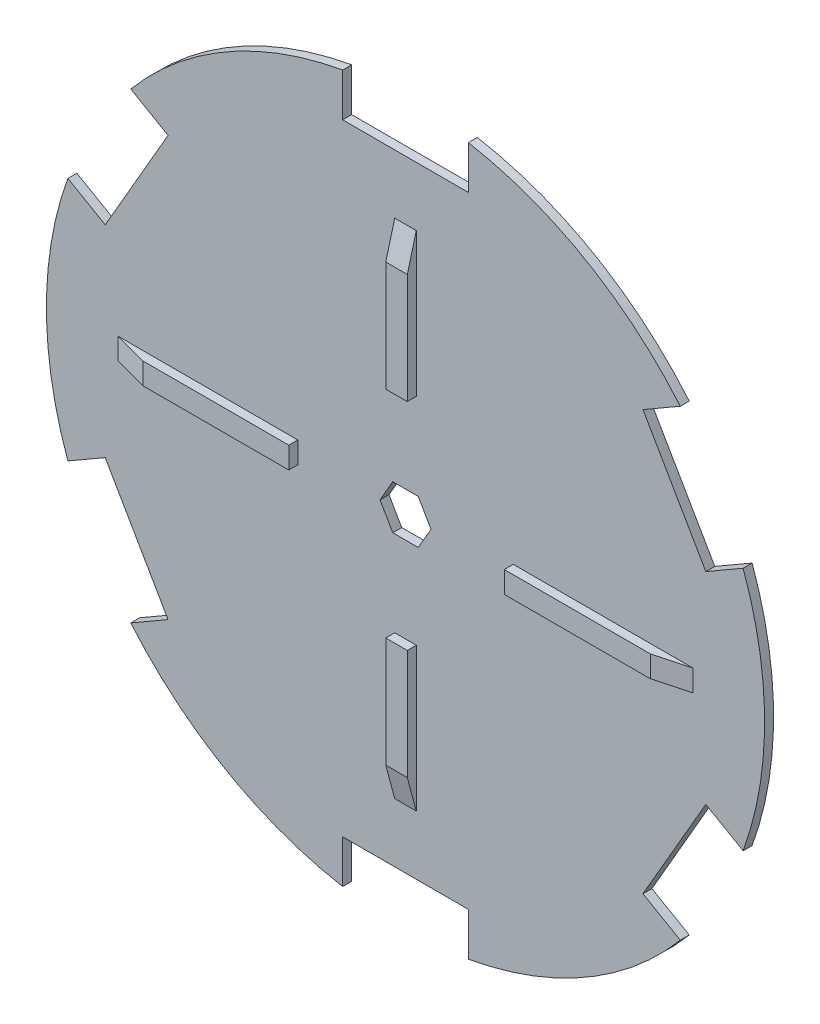
from build123d import *
from OCP.BRepFilletAPI import BRepFilletAPI_MakeChamfer

# Parameters (mm, degrees)
SKETCH1_R           = 100
BOSS_EXTRUDE1_DEPTH = 2.5
SKETCH8_W           = 1.221153846
SKETCH8_H           = 0.325641026
CUT_EXTRUDE6_DEPTH  = 0.2
CUT_EXTRUDE7_DEPTH  = 10
BOSS_EXTRUDE2_DEPTH = 2.5
CHAMFER1_SIZE       = 2.5
CHAMFER1_SIZE_2     = 9.330127019
CUT_EXTRUDE8_DEPTH  = 10


with BuildPart() as part:
    # Sketch1 → Boss-Extrude1 (new body)
    with BuildSketch(Plane.XY):
        Circle(SKETCH1_R)
    extrude(amount=BOSS_EXTRUDE1_DEPTH)

    # Sketch8 → Cut-Extrude6 (cut)
    # profile 1 of 12: a face of its own
    with BuildSketch(Plane(origin=(0, 0, 0), x_dir=(-1, 0, 0), z_dir=(0, 0, -1))):
        with BuildLine():
            add(Edge.make_bspline(
                [(-21.303796635, -42.5044388), (-21.303499075, -42.453550456), (-21.302921062, -42.354699113), (-21.296490852, -42.210658759), (-21.285808934, -42.075530497), (-21.271170032, -41.949307858), (-21.253355578, -41.831958258), (-21.229574387, -41.723795299), (-21.202529916, -41.62431837), (-21.171185911, -41.533203084), (-21.135818417, -41.449221882), (-21.09732448, -41.370821878), (-21.054176417, -41.298121696), (-21.008840217, -41.229960986), (-20.959480695, -41.167455492), (-20.907502507, -41.109722505), (-20.850876948, -41.058096324), (-20.791528933, -41.011064321), (-20.72892114, -40.969835158), (-20.66483815, -40.933519745), (-20.598838876, -40.902495579), (-20.530743124, -40.878102113), (-20.461162947, -40.857953702), (-20.389855107, -40.844175156), (-20.31670187, -40.835505675), (-20.267324783, -40.834676848), (-20.242283213, -40.834256508)],
                knots=[0, 0, 0, 0, 1.646270934, 3.197905019, 4.663502075, 6.030701355, 7.308322542, 8.50163776, 9.611534131, 10.641858119, 11.616356847, 12.558055219, 13.465016945, 14.349605745, 15.204443733, 16.039544428, 16.859896111, 17.680448484, 18.487036065, 19.28249412, 20.06191084, 20.843045899, 21.620316918, 22.403196591, 23.190181807, 24, 24, 24, 24], degree=3))
            add(Edge.make_bspline(
                [(-20.242283213, -40.834256508), (-20.217032458, -40.834699027), (-20.16681665, -40.835579056), (-20.092575738, -40.844037204), (-20.020049955, -40.858071722), (-19.949548501, -40.877957178), (-19.880492263, -40.902627542), (-19.813421379, -40.933549427), (-19.747919241, -40.969543828), (-19.685026766, -41.011838345), (-19.624053507, -41.058993695), (-19.566497141, -41.112299831), (-19.512352427, -41.171218505), (-19.460939829, -41.235119338), (-19.413717966, -41.305227951), (-19.368747781, -41.380324965), (-19.328496005, -41.461723678), (-19.28972955, -41.548065959), (-19.256267783, -41.64174085), (-19.226090547, -41.742220311), (-19.201707482, -41.850691181), (-19.181397214, -41.966584346), (-19.165662915, -42.09032542), (-19.154203304, -42.221649149), (-19.148149863, -42.360641932), (-19.147009855, -42.455672267), (-19.14642484, -42.5044388)],
                knots=[0, 0, 0, 0, 0.810914788, 1.612654377, 2.396697861, 3.181598691, 3.963628158, 4.749916497, 5.551656086, 6.361998678, 7.18212741, 8.025565596, 8.878627764, 9.750805457, 10.657531673, 11.591944965, 12.560506719, 13.57287815, 14.630710178, 15.753379473, 16.941251878, 18.199788006, 19.531962791, 20.947069417, 22.433333509, 24, 24, 24, 24], degree=3))
            add(Edge.make_bspline(
                [(-19.14642484, -42.5044388), (-19.14701592, -42.552992631), (-19.148167616, -42.64759779), (-19.154135443, -42.785965175), (-19.165890773, -42.916591971), (-19.180595548, -43.039791462), (-19.200961778, -43.155050874), (-19.226003608, -43.262769052), (-19.253807829, -43.363411174), (-19.288129392, -43.456152753), (-19.325694822, -43.54228753), (-19.366566322, -43.622721301), (-19.41035395, -43.698165009), (-19.458059454, -43.768014779), (-19.508907908, -43.832765418), (-19.563987616, -43.891273976), (-19.621745933, -43.944950228), (-19.682898624, -43.992712776), (-19.74677196, -44.034518277), (-19.812049122, -44.071905127), (-19.879888334, -44.102051929), (-19.948752227, -44.127937288), (-20.019625817, -44.147713412), (-20.092420757, -44.161387553), (-20.166766771, -44.170977729), (-20.217023905, -44.171709322), (-20.242283213, -44.172077021)],
                knots=[0, 0, 0, 0, 1.561518951, 3.042555995, 4.452378317, 5.7783523, 7.031515105, 8.214008947, 9.334062868, 10.386615937, 11.391082383, 12.354592575, 13.286541444, 14.194233754, 15.072674879, 15.931287219, 16.775624067, 17.606195743, 18.42308326, 19.229000347, 20.022332153, 20.807536673, 21.593273796, 22.3848459, 23.188221202, 24, 24, 24, 24], degree=3))
            add(Edge.make_bspline(
                [(-20.242283213, -44.172077021), (-20.267324088, -44.17165397), (-20.316699806, -44.170819796), (-20.389863077, -44.162189483), (-20.460876437, -44.148314276), (-20.530090306, -44.128886357), (-20.597859788, -44.105105755), (-20.663261419, -44.074123485), (-20.72702239, -44.038441865), (-20.788972587, -43.997806019), (-20.847947904, -43.951249921), (-20.904280211, -43.899756602), (-20.956554335, -43.842041078), (-21.005208122, -43.779014677), (-21.051448902, -43.711257236), (-21.093984262, -43.63784364), (-21.133327822, -43.559064986), (-21.169290132, -43.47441231), (-21.201174991, -43.38265034), (-21.229339697, -43.282729299), (-21.25157754, -43.173767258), (-21.270612078, -43.056639361), (-21.285964912, -42.930842295), (-21.296446335, -42.796307768), (-21.302924528, -42.653119614), (-21.303500628, -42.554903462), (-21.303796635, -42.5044388)],
                knots=[0, 0, 0, 0, 0.810891512, 1.598919785, 2.382837074, 3.152667961, 3.926044502, 4.706494248, 5.493654104, 6.291793342, 7.103789334, 7.925228297, 8.761435821, 9.622817696, 10.50288917, 11.416980706, 12.369136599, 13.353924996, 14.394355917, 15.514179734, 16.714354668, 17.994756427, 19.357759367, 20.818452758, 22.365282078, 24, 24, 24, 24], degree=3))
        make_face()
        with BuildLine():
            add(Edge.make_bspline(
                [(-21.018860737, -42.503166765), (-21.018752382, -42.545574513), (-21.018542085, -42.627879625), (-21.013048246, -42.747480298), (-21.005564107, -42.859031953), (-20.99591093, -42.962676233), (-20.981575398, -43.058062315), (-20.965512812, -43.145846242), (-20.945965617, -43.22556345), (-20.922837993, -43.297760964), (-20.896495384, -43.363664048), (-20.867733636, -43.424988007), (-20.836835695, -43.482457264), (-20.802256179, -43.535555608), (-20.764596086, -43.5844562), (-20.724706058, -43.630024555), (-20.681097357, -43.670661817), (-20.620768962, -43.71939975), (-20.541125017, -43.769763535), (-20.440776462, -43.813620345), (-20.337662938, -43.841181574), (-20.267675733, -43.844686552), (-20.232742949, -43.846435996)],
                knots=[0, 0, 0, 0, 1.459021318, 2.831673884, 4.118529203, 5.306027144, 6.411944654, 7.436330062, 8.375795394, 9.233974572, 10.042671642, 10.816086306, 11.563610507, 12.285937304, 12.993564865, 13.685989202, 14.367179055, 15.041617293, 16.353048772, 17.594441528, 18.799311195, 20, 20, 20, 20], degree=3))
            add(Edge.make_bspline(
                [(-20.232742949, -43.846435996), (-20.197584204, -43.84498658), (-20.127339304, -43.842090742), (-20.024710789, -43.814151887), (-19.925079044, -43.771997376), (-19.846999499, -43.722152139), (-19.787597477, -43.674682869), (-19.745037065, -43.63421101), (-19.705973635, -43.588893901), (-19.668924038, -43.53999954), (-19.634943305, -43.486593787), (-19.604043173, -43.42893345), (-19.575846137, -43.36685841), (-19.559781502, -43.323524433), (-19.551568069, -43.301368888)],
                knots=[0, 0, 0, 0, 1.353760809, 2.704726607, 4.075137775, 5.516104923, 6.260822281, 7.007110065, 7.778089737, 8.566572457, 9.372053459, 10.217411131, 11.088608312, 12, 12, 12, 12], degree=3))
            add(Edge.make_bspline(
                [(-19.551568069, -43.301368888), (-19.541996108, -43.273039053), (-19.522560923, -43.215517338), (-19.497513099, -43.126287454), (-19.477786916, -43.032667804), (-19.460040148, -42.935217877), (-19.447927019, -42.833219005), (-19.438177217, -42.726986785), (-19.432434379, -42.616441121), (-19.431722498, -42.541334236), (-19.431360737, -42.503166765)],
                knots=[0, 0, 0, 0, 0.884706709, 1.796334032, 2.740027952, 3.714592787, 4.726048262, 5.777819803, 6.87074269, 8, 8, 8, 8], degree=3))
            add(Edge.make_bspline(
                [(-19.431360737, -42.503166765), (-19.431859838, -42.465005467), (-19.432836184, -42.39035381), (-19.436568159, -42.281026604), (-19.446205259, -42.177187992), (-19.456908745, -42.078390635), (-19.47269051, -41.985181431), (-19.48970652, -41.896780083), (-19.51256762, -41.814281768), (-19.536987702, -41.736394861), (-19.564937132, -41.664004268), (-19.595703548, -41.596772476), (-19.628561858, -41.534374904), (-19.66425089, -41.47698275), (-19.702346974, -41.424338943), (-19.743855608, -41.377498989), (-19.787130289, -41.335011168), (-19.847743022, -41.286512981), (-19.927094699, -41.237063086), (-20.025833251, -41.191555575), (-20.128585906, -41.165422338), (-20.198048968, -41.161737808), (-20.232742949, -41.159897534)],
                knots=[0, 0, 0, 0, 1.31362396, 2.569729283, 3.763502607, 4.902122613, 5.988968491, 7.01645872, 7.998833611, 8.933434873, 9.825090667, 10.667526885, 11.477055099, 12.250526234, 12.991942729, 13.710640831, 14.402115721, 15.076753259, 16.378508321, 17.609869233, 18.806226677, 20, 20, 20, 20], degree=3))
            add(Edge.make_bspline(
                [(-20.232742949, -41.159897534), (-20.267858986, -41.161740346), (-20.338155033, -41.165429328), (-20.441975678, -41.191458208), (-20.541493197, -41.236827113), (-20.620635038, -41.286676765), (-20.681290045, -41.334155091), (-20.724000774, -41.375327088), (-20.764047658, -41.420363333), (-20.800939072, -41.469713642), (-20.835491493, -41.522750082), (-20.867224269, -41.57988989), (-20.895814989, -41.641422628), (-20.922198819, -41.707296108), (-20.945396991, -41.779487394), (-20.964532229, -41.859106409), (-20.98220977, -41.946611125), (-20.994724049, -42.042513822), (-21.005849028, -42.146184061), (-21.012998536, -42.2580142), (-21.018560463, -42.377815459), (-21.018758641, -42.460546124), (-21.018860737, -42.503166765)],
                knots=[0, 0, 0, 0, 1.207732386, 2.417664972, 3.655092373, 4.956220595, 5.625982001, 6.301752483, 6.994047911, 7.697131622, 8.419323945, 9.170223765, 9.943494443, 10.752040957, 11.610060368, 12.549350801, 13.567764191, 14.679664412, 15.874934091, 17.154273443, 18.533957287, 20, 20, 20, 20], degree=3))
        make_face(mode=Mode.SUBTRACT)
    # profile 2 of 12: a face of its own
    with BuildSketch(Plane(origin=(0, 0, 0), x_dir=(-1, 0, 0), z_dir=(0, 0, -1))):
        with BuildLine():
            Line((-18.45443766, -41.892589842), (-18.739373558, -41.892589842))
            add(Edge.make_bspline(
                [(-18.739373558, -41.892589842), (-18.737516498, -41.854788394), (-18.733869281, -41.780547355), (-18.716789333, -41.672303526), (-18.692350108, -41.56883953), (-18.657795718, -41.470986108), (-18.614882166, -41.377878047), (-18.563419927, -41.289885176), (-18.502465505, -41.207343169), (-18.433335111, -41.131017218), (-18.358252131, -41.060997065), (-18.277238886, -41.000531237), (-18.19210804, -40.949443064), (-18.103117871, -40.906733652), (-18.00926436, -40.874675363), (-17.911399196, -40.85088859), (-17.809092408, -40.836577191), (-17.73938753, -40.835038871), (-17.703936859, -40.834256508)],
                knots=[0, 0, 0, 0, 1.10065271, 2.161652631, 3.183658789, 4.190468796, 5.17591951, 6.163126047, 7.15150782, 8.156236427, 9.156009102, 10.134482811, 11.092018607, 12.041330605, 13.001268258, 13.972401359, 14.968799086, 16, 16, 16, 16], degree=3))
            add(Edge.make_bspline(
                [(-17.703936859, -40.834256508), (-17.669122463, -40.835071537), (-17.600713419, -40.836673038), (-17.500871449, -40.850426258), (-17.405823475, -40.871966902), (-17.315755287, -40.902188744), (-17.231385499, -40.942814617), (-17.152080309, -40.99161667), (-17.076895574, -41.048058946), (-17.009216563, -41.114510619), (-16.947069948, -41.185451354), (-16.893455759, -41.261186809), (-16.84754239, -41.33940909), (-16.809272137, -41.420714673), (-16.781099783, -41.505869105), (-16.75971098, -41.593632639), (-16.747621111, -41.684913718), (-16.74576562, -41.746696093), (-16.744822276, -41.778106669)],
                knots=[0, 0, 0, 0, 1.111607364, 2.184268762, 3.212621178, 4.221274766, 5.211760367, 6.196651075, 7.1921475, 8.207485113, 9.220403448, 10.201281604, 11.166441695, 12.114753415, 13.065576456, 14.026450734, 14.996634279, 16, 16, 16, 16], degree=3))
            add(Edge.make_bspline(
                [(-16.744822276, -41.778106669), (-16.746358307, -41.822327919), (-16.749403415, -41.909994398), (-16.775451456, -42.038822167), (-16.816133648, -42.163639054), (-16.865116965, -42.264093606), (-16.914531253, -42.345041133), (-16.959060635, -42.411687744), (-17.011189428, -42.483447704), (-17.071676351, -42.560080718), (-17.139270171, -42.642187039), (-17.214583134, -42.729717067), (-17.298152292, -42.821766459), (-17.356806789, -42.88463654), (-17.38720008, -42.917214241)],
                knots=[0, 0, 0, 0, 1.184426356, 2.348067706, 3.509069118, 4.696110526, 5.333549288, 6.050745305, 6.844228056, 7.710549037, 8.667450064, 9.695053472, 10.805634456, 12, 12, 12, 12], degree=3))
            Line((-17.38720008, -42.917214241), (-18.181586098, -43.765025739))
            Line((-18.181586098, -43.765025739), (-16.704117148, -43.765025739))
            Line((-16.704117148, -43.765025739), (-16.704117148, -44.090666765))
            Line((-16.704117148, -44.090666765), (-18.861488943, -44.090666765))
            Line((-18.861488943, -44.090666765), (-17.630158814, -42.776654345))
            add(Edge.make_bspline(
                [(-17.630158814, -42.776654345), (-17.60017966, -42.745359453), (-17.54259584, -42.685248369), (-17.461150216, -42.597488684), (-17.387999134, -42.516073029), (-17.322669071, -42.441155231), (-17.266577248, -42.371639452), (-17.216800295, -42.309777114), (-17.176917223, -42.252849863), (-17.133632542, -42.186863734), (-17.091709859, -42.106298275), (-17.055685079, -42.007842714), (-17.033718752, -41.906490135), (-17.031083652, -41.837999001), (-17.029758173, -41.803547374)],
                knots=[0, 0, 0, 0, 1.329631726, 2.553950428, 3.673215718, 4.687767853, 5.603093632, 6.413772471, 7.123043292, 7.734684054, 8.834405432, 9.900288307, 10.943827018, 12, 12, 12, 12], degree=3))
            add(Edge.make_bspline(
                [(-17.029758173, -41.803547374), (-17.030334882, -41.781883534), (-17.031471465, -41.739188265), (-17.041502377, -41.676590184), (-17.056661193, -41.616206389), (-17.078382963, -41.557851141), (-17.107054791, -41.502111157), (-17.141955643, -41.448918586), (-17.182223772, -41.397493596), (-17.228806709, -41.349275961), (-17.279980016, -41.305115153), (-17.334040514, -41.265995447), (-17.391235966, -41.233302825), (-17.451325219, -41.206502653), (-17.514140752, -41.185479271), (-17.579804057, -41.170911846), (-17.6481337, -41.161765592), (-17.694791229, -41.160528093), (-17.718565265, -41.159897534)],
                knots=[0, 0, 0, 0, 0.991446411, 1.95395049, 2.89581595, 3.838931463, 4.798493298, 5.75982156, 6.748411868, 7.785213223, 8.824556874, 9.840280684, 10.836137867, 11.835679398, 12.848801643, 13.863922112, 14.911575587, 16, 16, 16, 16], degree=3))
            add(Edge.make_bspline(
                [(-17.718565265, -41.159897534), (-17.74339452, -41.160546171), (-17.792155078, -41.161819985), (-17.863745915, -41.170730545), (-17.93204087, -41.186102843), (-17.997211739, -41.207127398), (-18.059368792, -41.23385051), (-18.118209747, -41.267135164), (-18.17360251, -41.306853047), (-18.225651214, -41.351884123), (-18.273606395, -41.402019733), (-18.315740346, -41.457908771), (-18.352555845, -41.518530783), (-18.384677078, -41.583722197), (-18.410762597, -41.654074554), (-18.430695384, -41.729338115), (-18.446467737, -41.809186083), (-18.451736895, -41.864326838), (-18.45443766, -41.892589842)],
                knots=[0, 0, 0, 0, 1.031018746, 2.02475058, 2.990194455, 3.934040569, 4.864654155, 5.795059489, 6.735614925, 7.690564532, 8.649604399, 9.611025574, 10.590972636, 11.591080095, 12.624614302, 13.701020113, 14.821632451, 16, 16, 16, 16], degree=3))
        make_face()
    # profile 3 of 12: a face of its own
    with BuildSketch(Plane(origin=(0, 0, 0), x_dir=(-1, 0, 0), z_dir=(0, 0, -1))):
        with Locations((-15.808604327, -42.869512919)):
            Rectangle(SKETCH8_W, SKETCH8_H)
    # profile 4 of 12: a face of its own
    with BuildSketch(Plane(origin=(0, 0, 0), x_dir=(-1, 0, 0), z_dir=(0, 0, -1))):
        with BuildLine():
            add(Edge.make_bspline(
                [(-14.953796635, -42.5044388), (-14.953499075, -42.453550456), (-14.952921062, -42.354699113), (-14.946490852, -42.210658759), (-14.935808934, -42.075530497), (-14.921170032, -41.949307858), (-14.903355578, -41.831958258), (-14.879574387, -41.723795299), (-14.852529916, -41.62431837), (-14.821185911, -41.533203084), (-14.785818417, -41.449221882), (-14.74732448, -41.370821878), (-14.704176417, -41.298121696), (-14.658840217, -41.229960986), (-14.609480695, -41.167455492), (-14.557502507, -41.109722505), (-14.500876948, -41.058096324), (-14.441528933, -41.011064321), (-14.37892114, -40.969835158), (-14.31483815, -40.933519745), (-14.248838876, -40.902495579), (-14.180743124, -40.878102113), (-14.111162947, -40.857953702), (-14.039855107, -40.844175156), (-13.96670187, -40.835505675), (-13.917324783, -40.834676848), (-13.892283213, -40.834256508)],
                knots=[0, 0, 0, 0, 1.646270934, 3.197905019, 4.663502075, 6.030701355, 7.308322542, 8.50163776, 9.611534131, 10.641858119, 11.616356847, 12.558055219, 13.465016945, 14.349605745, 15.204443733, 16.039544428, 16.859896111, 17.680448484, 18.487036065, 19.28249412, 20.06191084, 20.843045899, 21.620316918, 22.403196591, 23.190181807, 24, 24, 24, 24], degree=3))
            add(Edge.make_bspline(
                [(-13.892283213, -40.834256508), (-13.867032458, -40.834699027), (-13.81681665, -40.835579056), (-13.742575738, -40.844037204), (-13.670049955, -40.858071722), (-13.599548501, -40.877957178), (-13.530492263, -40.902627542), (-13.463421379, -40.933549427), (-13.397919241, -40.969543828), (-13.335026766, -41.011838345), (-13.274053507, -41.058993695), (-13.216497141, -41.112299831), (-13.162352427, -41.171218505), (-13.110939829, -41.235119338), (-13.063717966, -41.305227951), (-13.018747781, -41.380324965), (-12.978496005, -41.461723678), (-12.93972955, -41.548065959), (-12.906267783, -41.64174085), (-12.876090547, -41.742220311), (-12.851707482, -41.850691181), (-12.831397214, -41.966584346), (-12.815662915, -42.09032542), (-12.804203304, -42.221649149), (-12.798149863, -42.360641932), (-12.797009855, -42.455672267), (-12.79642484, -42.5044388)],
                knots=[0, 0, 0, 0, 0.810914788, 1.612654377, 2.396697861, 3.181598691, 3.963628158, 4.749916497, 5.551656086, 6.361998678, 7.18212741, 8.025565596, 8.878627764, 9.750805457, 10.657531673, 11.591944965, 12.560506719, 13.57287815, 14.630710178, 15.753379473, 16.941251878, 18.199788006, 19.531962791, 20.947069417, 22.433333509, 24, 24, 24, 24], degree=3))
            add(Edge.make_bspline(
                [(-12.79642484, -42.5044388), (-12.79701592, -42.552992631), (-12.798167616, -42.64759779), (-12.804135443, -42.785965175), (-12.815890773, -42.916591971), (-12.830595548, -43.039791462), (-12.850961778, -43.155050874), (-12.876003608, -43.262769052), (-12.903807829, -43.363411174), (-12.938129392, -43.456152753), (-12.975694822, -43.54228753), (-13.016566322, -43.622721301), (-13.06035395, -43.698165009), (-13.108059454, -43.768014779), (-13.158907908, -43.832765418), (-13.213987616, -43.891273976), (-13.271745933, -43.944950228), (-13.332898624, -43.992712776), (-13.39677196, -44.034518277), (-13.462049122, -44.071905127), (-13.529888334, -44.102051929), (-13.598752227, -44.127937288), (-13.669625817, -44.147713412), (-13.742420757, -44.161387553), (-13.816766771, -44.170977729), (-13.867023905, -44.171709322), (-13.892283213, -44.172077021)],
                knots=[0, 0, 0, 0, 1.561518951, 3.042555995, 4.452378317, 5.7783523, 7.031515105, 8.214008947, 9.334062868, 10.386615937, 11.391082383, 12.354592575, 13.286541444, 14.194233754, 15.072674879, 15.931287219, 16.775624067, 17.606195743, 18.42308326, 19.229000347, 20.022332153, 20.807536673, 21.593273796, 22.3848459, 23.188221202, 24, 24, 24, 24], degree=3))
            add(Edge.make_bspline(
                [(-13.892283213, -44.172077021), (-13.917324088, -44.17165397), (-13.966699806, -44.170819796), (-14.039863077, -44.162189483), (-14.110876437, -44.148314276), (-14.180090306, -44.128886357), (-14.247859788, -44.105105755), (-14.313261419, -44.074123485), (-14.37702239, -44.038441865), (-14.438972587, -43.997806019), (-14.497947904, -43.951249921), (-14.554280211, -43.899756602), (-14.606554335, -43.842041078), (-14.655208122, -43.779014677), (-14.701448902, -43.711257236), (-14.743984262, -43.63784364), (-14.783327822, -43.559064986), (-14.819290132, -43.47441231), (-14.851174991, -43.38265034), (-14.879339697, -43.282729299), (-14.90157754, -43.173767258), (-14.920612078, -43.056639361), (-14.935964912, -42.930842295), (-14.946446335, -42.796307768), (-14.952924528, -42.653119614), (-14.953500628, -42.554903462), (-14.953796635, -42.5044388)],
                knots=[0, 0, 0, 0, 0.810891512, 1.598919785, 2.382837074, 3.152667961, 3.926044502, 4.706494248, 5.493654104, 6.291793342, 7.103789334, 7.925228297, 8.761435821, 9.622817696, 10.50288917, 11.416980706, 12.369136599, 13.353924996, 14.394355917, 15.514179734, 16.714354668, 17.994756427, 19.357759367, 20.818452758, 22.365282078, 24, 24, 24, 24], degree=3))
        make_face()
        with BuildLine():
            add(Edge.make_bspline(
                [(-14.668860737, -42.503166765), (-14.668752382, -42.545574513), (-14.668542085, -42.627879625), (-14.663048246, -42.747480298), (-14.655564107, -42.859031953), (-14.64591093, -42.962676233), (-14.631575398, -43.058062315), (-14.615512812, -43.145846242), (-14.595965617, -43.22556345), (-14.572837993, -43.297760964), (-14.546495384, -43.363664048), (-14.517733636, -43.424988007), (-14.486835695, -43.482457264), (-14.452256179, -43.535555608), (-14.414596086, -43.5844562), (-14.374706058, -43.630024555), (-14.331097357, -43.670661817), (-14.270768962, -43.71939975), (-14.191125017, -43.769763535), (-14.090776462, -43.813620345), (-13.987662938, -43.841181574), (-13.917675733, -43.844686552), (-13.882742949, -43.846435996)],
                knots=[0, 0, 0, 0, 1.459021318, 2.831673884, 4.118529203, 5.306027144, 6.411944654, 7.436330062, 8.375795394, 9.233974572, 10.042671642, 10.816086306, 11.563610507, 12.285937304, 12.993564865, 13.685989202, 14.367179055, 15.041617293, 16.353048772, 17.594441528, 18.799311195, 20, 20, 20, 20], degree=3))
            add(Edge.make_bspline(
                [(-13.882742949, -43.846435996), (-13.847584204, -43.84498658), (-13.777339304, -43.842090742), (-13.674710789, -43.814151887), (-13.575079044, -43.771997376), (-13.496999499, -43.722152139), (-13.437597477, -43.674682869), (-13.395037065, -43.63421101), (-13.355973635, -43.588893901), (-13.318924038, -43.53999954), (-13.284943305, -43.486593787), (-13.254043173, -43.42893345), (-13.225846137, -43.36685841), (-13.209781502, -43.323524433), (-13.201568069, -43.301368888)],
                knots=[0, 0, 0, 0, 1.353760809, 2.704726607, 4.075137775, 5.516104923, 6.260822281, 7.007110065, 7.778089737, 8.566572457, 9.372053459, 10.217411131, 11.088608312, 12, 12, 12, 12], degree=3))
            add(Edge.make_bspline(
                [(-13.201568069, -43.301368888), (-13.191996108, -43.273039053), (-13.172560923, -43.215517338), (-13.147513099, -43.126287454), (-13.127786916, -43.032667804), (-13.110040148, -42.935217877), (-13.097927019, -42.833219005), (-13.088177217, -42.726986785), (-13.082434379, -42.616441121), (-13.081722498, -42.541334236), (-13.081360737, -42.503166765)],
                knots=[0, 0, 0, 0, 0.884706709, 1.796334032, 2.740027952, 3.714592787, 4.726048262, 5.777819803, 6.87074269, 8, 8, 8, 8], degree=3))
            add(Edge.make_bspline(
                [(-13.081360737, -42.503166765), (-13.081859838, -42.465005467), (-13.082836184, -42.39035381), (-13.086568159, -42.281026604), (-13.096205259, -42.177187992), (-13.106908745, -42.078390635), (-13.12269051, -41.985181431), (-13.13970652, -41.896780083), (-13.16256762, -41.814281768), (-13.186987702, -41.736394861), (-13.214937132, -41.664004268), (-13.245703548, -41.596772476), (-13.278561858, -41.534374904), (-13.31425089, -41.47698275), (-13.352346974, -41.424338943), (-13.393855608, -41.377498989), (-13.437130289, -41.335011168), (-13.497743022, -41.286512981), (-13.577094699, -41.237063086), (-13.675833251, -41.191555575), (-13.778585906, -41.165422338), (-13.848048968, -41.161737808), (-13.882742949, -41.159897534)],
                knots=[0, 0, 0, 0, 1.31362396, 2.569729283, 3.763502607, 4.902122613, 5.988968491, 7.01645872, 7.998833611, 8.933434873, 9.825090667, 10.667526885, 11.477055099, 12.250526234, 12.991942729, 13.710640831, 14.402115721, 15.076753259, 16.378508321, 17.609869233, 18.806226677, 20, 20, 20, 20], degree=3))
            add(Edge.make_bspline(
                [(-13.882742949, -41.159897534), (-13.917858986, -41.161740346), (-13.988155033, -41.165429328), (-14.091975678, -41.191458208), (-14.191493197, -41.236827113), (-14.270635038, -41.286676765), (-14.331290045, -41.334155091), (-14.374000774, -41.375327088), (-14.414047658, -41.420363333), (-14.450939072, -41.469713642), (-14.485491493, -41.522750082), (-14.517224269, -41.57988989), (-14.545814989, -41.641422628), (-14.572198819, -41.707296108), (-14.595396991, -41.779487394), (-14.614532229, -41.859106409), (-14.63220977, -41.946611125), (-14.644724049, -42.042513822), (-14.655849028, -42.146184061), (-14.662998536, -42.2580142), (-14.668560463, -42.377815459), (-14.668758641, -42.460546124), (-14.668860737, -42.503166765)],
                knots=[0, 0, 0, 0, 1.207732386, 2.417664972, 3.655092373, 4.956220595, 5.625982001, 6.301752483, 6.994047911, 7.697131622, 8.419323945, 9.170223765, 9.943494443, 10.752040957, 11.610060368, 12.549350801, 13.567764191, 14.679664412, 15.874934091, 17.154273443, 18.533957287, 20, 20, 20, 20], degree=3))
        make_face(mode=Mode.SUBTRACT)
    # profile 5 of 12: a face of its own
    with BuildSketch(Plane(origin=(0, 0, 0), x_dir=(-1, 0, 0), z_dir=(0, 0, -1))):
        Polygon((-10.778340906, -40.834256508), (-10.720463301, -40.834256508), (-10.720463301, -43.032333432), (-10.354117148, -43.032333432), (-10.354117148, -43.357974457), (-10.720463301, -43.357974457), (-10.720463301, -44.090666765), (-11.005399199, -44.090666765), (-11.005399199, -43.357974457), (-12.511488943, -43.357974457), align=None)
        Polygon((-11.005399199, -43.032333432), (-11.005399199, -41.653447214), (-11.95179343, -43.032333432), align=None, mode=Mode.SUBTRACT)
    # profile 6 of 12: a face of its own
    with BuildSketch(Plane(origin=(0, 0, 0), x_dir=(-1, 0, 0), z_dir=(0, 0, -1))):
        with Locations((-9.458604327, -42.869512919)):
            Rectangle(SKETCH8_W, SKETCH8_H)
    # profile 7 of 12: a face of its own
    with BuildSketch(Plane(origin=(0, 0, 0), x_dir=(-1, 0, 0), z_dir=(0, 0, -1))):
        Polygon((-7.928981931, -40.915666765), (-7.34193766, -40.915666765), (-7.34193766, -44.090666765), (-7.626873558, -44.090666765), (-7.626873558, -41.241307791), (-8.115335096, -41.241307791), align=None)
    # profile 8 of 12: a face of its own
    with BuildSketch(Plane(origin=(0, 0, 0), x_dir=(-1, 0, 0), z_dir=(0, 0, -1))):
        Polygon((-4.428340906, -40.834256508), (-4.370463301, -40.834256508), (-4.370463301, -43.032333432), (-4.004117148, -43.032333432), (-4.004117148, -43.357974457), (-4.370463301, -43.357974457), (-4.370463301, -44.090666765), (-4.655399199, -44.090666765), (-4.655399199, -43.357974457), (-6.161488943, -43.357974457), align=None)
        Polygon((-4.655399199, -43.032333432), (-4.655399199, -41.653447214), (-5.60179343, -43.032333432), align=None, mode=Mode.SUBTRACT)
    # profile 9 of 12: a face of its own
    with BuildSketch(Plane(origin=(0, 0, 0), x_dir=(-1, 0, 0), z_dir=(0, 0, -1))):
        Polygon((-3.044366547, -40.915666765), (-2.457322276, -40.915666765), (-2.457322276, -44.090666765), (-2.742258173, -44.090666765), (-2.742258173, -41.241307791), (-3.230719712, -41.241307791), align=None)
    # profile 10 of 12: a face of its own
    with BuildSketch(Plane(origin=(0, 0, 0), x_dir=(-1, 0, 0), z_dir=(0, 0, -1))):
        Polygon((-0.602058854, -40.915666765), (-0.015014584, -40.915666765), (-0.015014584, -44.090666765), (-0.299950481, -44.090666765), (-0.299950481, -41.241307791), (-0.788412019, -41.241307791), align=None)
    # profile 11 of 12: a face of its own
    with BuildSketch(Plane(origin=(0, 0, 0), x_dir=(-1, 0, 0), z_dir=(0, 0, -1))):
        Polygon((1.840248838, -40.915666765), (2.427293109, -40.915666765), (2.427293109, -44.090666765), (2.142357211, -44.090666765), (2.142357211, -41.241307791), (1.653895673, -41.241307791), align=None)
    # profile 12 of 12: a face of its own
    with BuildSketch(Plane(origin=(0, 0, 0), x_dir=(-1, 0, 0), z_dir=(0, 0, -1))):
        with BuildLine():
            add(Edge.make_bspline(
                [(5.15135661, -42.321901741), (5.177344935, -42.335452601), (5.228030848, -42.361881304), (5.300218744, -42.404436126), (5.36619071, -42.449286144), (5.427777148, -42.494312959), (5.483896045, -42.541240957), (5.533919905, -42.590256749), (5.579084389, -42.640136857), (5.618478685, -42.691725926), (5.653128673, -42.7448869), (5.683075396, -42.799759312), (5.70867243, -42.856222908), (5.72895881, -42.914894032), (5.745670007, -42.974910841), (5.757168591, -43.037048296), (5.763352509, -43.100896948), (5.764521647, -43.144048193), (5.765113622, -43.165897133)],
                knots=[0, 0, 0, 0, 1.272397273, 2.481599622, 3.635517121, 4.734568067, 5.792894095, 6.808321871, 7.773003508, 8.711915296, 9.623354172, 10.525449501, 11.423591555, 12.311487226, 13.218079475, 14.126165749, 15.051214107, 16, 16, 16, 16], degree=3))
            add(Edge.make_bspline(
                [(5.765113622, -43.165897133), (5.764413833, -43.196465791), (5.763028689, -43.256972634), (5.750963703, -43.346277321), (5.732899787, -43.433010866), (5.706520515, -43.517154254), (5.672309082, -43.598243185), (5.630147952, -43.676347073), (5.582422073, -43.752746017), (5.544093256, -43.799753618), (5.524698958, -43.823539361)],
                knots=[0, 0, 0, 0, 1.025265484, 2.029385089, 3.018602448, 3.995076438, 4.983346944, 5.966715145, 6.97116228, 8, 8, 8, 8], degree=3))
            add(Edge.make_bspline(
                [(5.524698958, -43.823539361), (5.499447299, -43.851292285), (5.449256023, -43.906455182), (5.363274368, -43.978074845), (5.268911659, -44.038263224), (5.166533028, -44.087314157), (5.056412144, -44.125492043), (4.938572468, -44.152926327), (4.812784272, -44.168640245), (4.726328595, -44.170911722), (4.681975601, -44.172077021)],
                knots=[0, 0, 0, 0, 0.954267603, 1.896743057, 2.838368354, 3.796610408, 4.779680527, 5.799409237, 6.871065594, 8, 8, 8, 8], degree=3))
            add(Edge.make_bspline(
                [(4.681975601, -44.172077021), (4.639327741, -44.171031559), (4.556339338, -44.168997196), (4.435546121, -44.155213676), (4.322948764, -44.131058397), (4.217892579, -44.09799793), (4.121010907, -44.05499008), (4.032579808, -44.001461023), (3.951323419, -43.939565358), (3.879707689, -43.867525444), (3.816127458, -43.790365803), (3.760276439, -43.710762557), (3.713854239, -43.62870844), (3.674550374, -43.545426949), (3.644462239, -43.459750795), (3.623623162, -43.372120783), (3.61038857, -43.282689975), (3.608627684, -43.222336261), (3.607741827, -43.191973856)],
                knots=[0, 0, 0, 0, 1.256902934, 2.445805442, 3.576955095, 4.645999104, 5.686449165, 6.692658513, 7.68621702, 8.689161843, 9.678783111, 10.630372946, 11.551080876, 12.453998257, 13.34127905, 14.221779781, 15.105423033, 16, 16, 16, 16], degree=3))
            add(Edge.make_bspline(
                [(3.607741827, -43.191973856), (3.608266047, -43.169695161), (3.609302092, -43.125664595), (3.616472919, -43.06061399), (3.628001309, -42.997298924), (3.643658102, -42.935485536), (3.664877104, -42.875623838), (3.690496754, -42.817430194), (3.720370739, -42.760838905), (3.754915796, -42.705540491), (3.795104061, -42.652309791), (3.840609657, -42.600243424), (3.892342081, -42.550149302), (3.949725814, -42.501415388), (4.012105075, -42.453177183), (4.081100121, -42.408041629), (4.154881921, -42.362813333), (4.207319682, -42.335772923), (4.234219191, -42.321901741)],
                knots=[0, 0, 0, 0, 0.941657376, 1.861047343, 2.762797495, 3.66048619, 4.553285746, 5.444104102, 6.34607688, 7.256116206, 8.197091036, 9.162375105, 10.176350973, 11.237807142, 12.343728897, 13.50695164, 14.721116704, 16, 16, 16, 16], degree=3))
            add(Edge.make_bspline(
                [(4.234219191, -42.321901741), (4.197397015, -42.301822344), (4.126098976, -42.26294301), (4.031693126, -42.191508408), (3.950603061, -42.114140176), (3.88505771, -42.029204576), (3.833466474, -41.939354912), (3.798071026, -41.84515334), (3.774125644, -41.74834658), (3.771753622, -41.682210244), (3.77056234, -41.64899509)],
                knots=[0, 0, 0, 0, 1.166880483, 2.259407225, 3.286803203, 4.280235371, 5.237608625, 6.161067461, 7.076446754, 8, 8, 8, 8], degree=3))
            add(Edge.make_bspline(
                [(3.77056234, -41.64899509), (3.772045903, -41.615160877), (3.775028124, -41.547148206), (3.799142993, -41.445905509), (3.838440482, -41.346467625), (3.891890244, -41.249316514), (3.958462933, -41.157740248), (4.038333728, -41.075606675), (4.12959529, -41.00365983), (4.231792069, -40.943265731), (4.341770654, -40.894113412), (4.45780849, -40.860205842), (4.577883809, -40.838038794), (4.659615311, -40.835529043), (4.70105613, -40.834256508)],
                knots=[0, 0, 0, 0, 0.888701115, 1.786444228, 2.72001202, 3.692817113, 4.693886446, 5.687152267, 6.695133018, 7.739871481, 8.800368666, 9.853104506, 10.91144658, 12, 12, 12, 12], degree=3))
            add(Edge.make_bspline(
                [(4.70105613, -40.834256508), (4.741427447, -40.835568548), (4.821035087, -40.838155741), (4.938051642, -40.859733838), (5.050015638, -40.895774188), (5.156540969, -40.944666669), (5.255720592, -41.004889108), (5.343352687, -41.077824187), (5.420761529, -41.159595451), (5.484791658, -41.251143948), (5.537553708, -41.347921752), (5.574293811, -41.449179325), (5.597835959, -41.552728828), (5.600805368, -41.622794732), (5.602293109, -41.657899337)],
                knots=[0, 0, 0, 0, 1.072916533, 2.115669174, 3.151510826, 4.193348718, 5.225979165, 6.227137561, 7.216255879, 8.211077061, 9.189680878, 10.138522389, 11.067357538, 12, 12, 12, 12], degree=3))
            add(Edge.make_bspline(
                [(5.602293109, -41.657899337), (5.600991757, -41.692349596), (5.598435977, -41.760007948), (5.576936746, -41.858638434), (5.540729669, -41.951005569), (5.491295678, -42.038157462), (5.426865415, -42.118513535), (5.348298921, -42.193095618), (5.25622258, -42.262516384), (5.187043062, -42.301692586), (5.15135661, -42.321901741)],
                knots=[0, 0, 0, 0, 0.975232327, 1.915300861, 2.843280834, 3.77672583, 4.742871857, 5.749627742, 6.839139064, 8, 8, 8, 8], degree=3))
        make_face()
        with BuildLine():
            add(Edge.make_bspline(
                [(4.685155689, -41.159897534), (4.662884601, -41.160488484), (4.619312614, -41.16164464), (4.555423748, -41.167684975), (4.494670244, -41.179435393), (4.436417339, -41.195073367), (4.381463702, -41.216198899), (4.329062999, -41.241050086), (4.280107048, -41.271263445), (4.234004866, -41.305155389), (4.192502378, -41.342432525), (4.155668249, -41.381270685), (4.125072031, -41.422432647), (4.099090453, -41.464894516), (4.080238648, -41.509916539), (4.066119601, -41.556118392), (4.056575196, -41.604083919), (4.055860013, -41.636864897), (4.055498237, -41.653447214)],
                knots=[0, 0, 0, 0, 1.203892937, 2.355340988, 3.463153438, 4.544400666, 5.610487187, 6.640501085, 7.674077295, 8.714426146, 9.728707835, 10.68524104, 11.601827946, 12.495867327, 13.368432065, 14.231010473, 15.105153427, 16, 16, 16, 16], degree=3))
            add(Edge.make_bspline(
                [(4.055498237, -41.653447214), (4.056121777, -41.670030247), (4.057353982, -41.702800704), (4.066883633, -41.751193025), (4.081086637, -41.798746939), (4.103448309, -41.844331694), (4.13026922, -41.889528598), (4.163372201, -41.933208058), (4.202822962, -41.975522086), (4.247297855, -42.016110779), (4.29574975, -42.054118943), (4.34707956, -42.087114614), (4.400643073, -42.1147227), (4.45588995, -42.137700089), (4.513383256, -42.155561675), (4.572770699, -42.168233233), (4.634062262, -42.176109044), (4.675591789, -42.177049771), (4.696604006, -42.177525739)],
                knots=[0, 0, 0, 0, 0.873023192, 1.725219244, 2.590779336, 3.480155217, 4.391973325, 5.357036234, 6.360879153, 7.436073238, 8.526419356, 9.601555421, 10.645666583, 11.697338044, 12.750135903, 13.812665442, 14.89329948, 16, 16, 16, 16], degree=3))
            add(Edge.make_bspline(
                [(4.696604006, -42.177525739), (4.7235916, -42.176733924), (4.777300234, -42.175158114), (4.856475056, -42.160506692), (4.933457598, -42.137459896), (5.007425033, -42.105927641), (5.076462763, -42.066350939), (5.138003397, -42.01896813), (5.191522007, -41.964873299), (5.236462417, -41.904908584), (5.271305635, -41.841089643), (5.298430847, -41.777045091), (5.314270663, -41.712091639), (5.316336742, -41.66857875), (5.317357211, -41.647087037)],
                knots=[0, 0, 0, 0, 1.076279235, 2.141928126, 3.20205304, 4.278698113, 5.344010996, 6.36967002, 7.368914609, 8.37248503, 9.349703398, 10.264243087, 11.142681841, 12, 12, 12, 12], degree=3))
            add(Edge.make_bspline(
                [(5.317357211, -41.647087037), (5.316874704, -41.632003033), (5.315916997, -41.602063447), (5.308024803, -41.557850787), (5.294983869, -41.514643951), (5.277328075, -41.472086005), (5.254096333, -41.430774056), (5.226551677, -41.390058683), (5.193092165, -41.350855811), (5.155539686, -41.31225185), (5.112953494, -41.276524914), (5.065415659, -41.245106284), (5.0131699, -41.218425075), (4.956214981, -41.196754561), (4.894760657, -41.180478287), (4.829089978, -41.1682896), (4.758655372, -41.161419706), (4.710186955, -41.160415929), (4.685155689, -41.159897534)],
                knots=[0, 0, 0, 0, 0.814439003, 1.616544685, 2.417341072, 3.248991801, 4.09997495, 4.973547432, 5.9003056, 6.880240646, 7.880314356, 8.896779544, 9.951930927, 11.043077905, 12.18215768, 13.381699519, 14.647792085, 16, 16, 16, 16], degree=3))
        make_face(mode=Mode.SUBTRACT)
        with BuildLine():
            add(Edge.make_bspline(
                [(4.7036002, -42.503166765), (4.675364666, -42.503668997), (4.619973438, -42.504654253), (4.538823224, -42.515621157), (4.460942139, -42.530887821), (4.386592768, -42.554047938), (4.315806508, -42.584161897), (4.248200161, -42.62038823), (4.184290922, -42.663210311), (4.124961306, -42.712084098), (4.070783714, -42.764752317), (4.02325097, -42.820507253), (3.982885363, -42.878312694), (3.950379485, -42.938902788), (3.923698842, -43.000994549), (3.906178397, -43.066134296), (3.894946415, -43.133069749), (3.893438171, -43.178572124), (3.892677724, -43.201514121)],
                knots=[0, 0, 0, 0, 1.140299081, 2.23698856, 3.303958914, 4.344563908, 5.37730929, 6.408454204, 7.439741482, 8.480804886, 9.510774543, 10.48932336, 11.43758569, 12.353841022, 13.263987381, 14.161954604, 15.073269652, 16, 16, 16, 16], degree=3))
            add(Edge.make_bspline(
                [(3.892677724, -43.201514121), (3.893914395, -43.230026443), (3.89636792, -43.286594223), (3.915832157, -43.370199295), (3.947070107, -43.451135538), (3.990635838, -43.528743381), (4.044581422, -43.601269548), (4.110917575, -43.664487223), (4.185521764, -43.72065885), (4.270918245, -43.766089049), (4.364198354, -43.802370096), (4.465337279, -43.82736729), (4.572883527, -43.843914891), (4.647141871, -43.845582384), (4.685155689, -43.846435996)],
                knots=[0, 0, 0, 0, 0.898778495, 1.783155532, 2.693654817, 3.627872908, 4.583023416, 5.533784346, 6.509005473, 7.520592997, 8.575161974, 9.658835044, 10.801527049, 12, 12, 12, 12], degree=3))
            add(Edge.make_bspline(
                [(4.685155689, -43.846435996), (4.714864951, -43.845865577), (4.772748121, -43.844754217), (4.857190375, -43.834944108), (4.93687793, -43.819386948), (5.011656254, -43.796759589), (5.082362452, -43.76913711), (5.147797708, -43.733602436), (5.209645372, -43.693187114), (5.264857827, -43.645237215), (5.315143666, -43.594002245), (5.358988867, -43.539764134), (5.39705036, -43.483996954), (5.426923441, -43.425440443), (5.450805114, -43.365218027), (5.467971482, -43.302774385), (5.478563477, -43.237917995), (5.479634718, -43.193922409), (5.480177724, -43.171621292)],
                knots=[0, 0, 0, 0, 1.224942928, 2.386581632, 3.501229538, 4.569074225, 5.605009692, 6.626002462, 7.634866581, 8.645888296, 9.63523824, 10.59253846, 11.518950513, 12.414518923, 13.29783783, 14.186679152, 15.080837789, 16, 16, 16, 16], degree=3))
            add(Edge.make_bspline(
                [(5.480177724, -43.171621292), (5.47935599, -43.149961133), (5.477735674, -43.107251083), (5.467451676, -43.043962877), (5.44938513, -42.982818896), (5.424595277, -42.923083533), (5.391592547, -42.865967142), (5.352726129, -42.809981758), (5.305832178, -42.756681269), (5.252843609, -42.705651675), (5.195095837, -42.658465971), (5.13371207, -42.616724301), (5.069164808, -42.581570596), (5.001590638, -42.552980632), (4.931139606, -42.530494856), (4.857863528, -42.514786775), (4.781676614, -42.504899278), (4.729919695, -42.503750794), (4.7036002, -42.503166765)],
                knots=[0, 0, 0, 0, 0.917430815, 1.809013306, 2.70690318, 3.612392954, 4.541220862, 5.495268465, 6.494511384, 7.542276156, 8.608045339, 9.649016899, 10.681629292, 11.715607085, 12.752076957, 13.808767841, 14.885711793, 16, 16, 16, 16], degree=3))
        make_face(mode=Mode.SUBTRACT)
    extrude(amount=-CUT_EXTRUDE6_DEPTH, mode=Mode.SUBTRACT)

    # Sketch9 → Cut-Extrude7 (cut)
    with BuildSketch(Plane.XY.offset(2.5)):
        Polygon((-7.101408311, 0), (-3.550704156, -6.15), (3.550704156, -6.15), (7.101408311, 0), (3.550704156, 6.15), (-3.550704156, 6.15), align=None)
    extrude(amount=-CUT_EXTRUDE7_DEPTH, mode=Mode.SUBTRACT)

    # Sketch11 → Boss-Extrude2 (add)
    with BuildSketch(Plane.XY.offset(2.5)):
        Polygon((-80, 0), (-80, 3), (-30, 3), (-30, -3), (-80, -3), align=None)
        Polygon((0, 70), (-3, 70), (-3, 30), (3, 30), (3, 70), align=None)
        Polygon((30, 3), (80, 3), (80, 0), (80, -3), (30, -3), align=None)
        Polygon((3, -30), (-3, -30), (-3, -70), (0, -70), (3, -70), align=None)
    extrude(amount=BOSS_EXTRUDE2_DEPTH)

    # Chamfer1
    chamfer1_edges_1 = [part.edges().sort_by_distance(p)[0] for p in [
        (80, 0, 5),
    ]]
    chamfer1_side_1 = [part.faces().sort_by_distance(p)[0] for p in [
        (80, 0, 4.95),
    ]]
    chamfer1_edges_2 = [part.edges().sort_by_distance(p)[0] for p in [
        (0, 70, 5),
    ]]
    chamfer1_side_2 = [part.faces().sort_by_distance(p)[0] for p in [
        (0, 70, 4.95),
    ]]
    chamfer1_edges_3 = [part.edges().sort_by_distance(p)[0] for p in [
        (0, -70, 5),
    ]]
    chamfer1_side_3 = [part.faces().sort_by_distance(p)[0] for p in [
        (0, -70, 4.95),
    ]]
    chamfer1_edges_4 = [part.edges().sort_by_distance(p)[0] for p in [
        (-80, 0, 5),
    ]]
    chamfer1_side_4 = [part.faces().sort_by_distance(p)[0] for p in [
        (-80, 0, 4.95),
    ]]
    chamfer1 = BRepFilletAPI_MakeChamfer(part.part.solid().wrapped)
    for e in chamfer1_edges_1:
        chamfer1.Add(CHAMFER1_SIZE - 0.0001, CHAMFER1_SIZE_2 - 0.0001, e.wrapped, chamfer1_side_1[0].wrapped)
    for e in chamfer1_edges_2:
        chamfer1.Add(CHAMFER1_SIZE - 0.0001, CHAMFER1_SIZE_2 - 0.0001, e.wrapped, chamfer1_side_2[0].wrapped)
    for e in chamfer1_edges_3:
        chamfer1.Add(CHAMFER1_SIZE - 0.0001, CHAMFER1_SIZE_2 - 0.0001, e.wrapped, chamfer1_side_3[0].wrapped)
    for e in chamfer1_edges_4:
        chamfer1.Add(CHAMFER1_SIZE - 0.0001, CHAMFER1_SIZE_2 - 0.0001, e.wrapped, chamfer1_side_4[0].wrapped)
    add(Compound.cast(chamfer1.Shape()), mode=Mode.REPLACE)  # a hair under: the kernel refuses the full size

    # Sketch12 → Cut-Extrude8 (cut)
    with BuildSketch(Plane.XY.offset(2.5)):
        Polygon((-83.623822661, -28.072977103), (-94.016127507, -34.072977103), (-100.191144302, -37.638124711), (-82.691144302, -67.949013844), (-76.516127507, -64.383866235), (-66.123822661, -58.383866235), (-74.873822661, -43.228421669), align=None)
        Polygon((0, -86.456843338), (-17.5, -86.456843338), (-17.5, -98.456843338), (-17.5, -105.587138555), (17.5, -105.587138555), (17.5, -98.456843338), (17.5, -86.456843338), align=None)
        Polygon((-66.123822661, 58.383866235), (-76.516127507, 64.383866235), (-82.691144302, 67.949013844), (-100.191144302, 37.638124711), (-94.016127507, 34.072977103), (-83.623822661, 28.072977103), (-74.873822661, 43.228421669), align=None)
        Polygon((17.5, 86.456843338), (17.5, 98.456843338), (17.5, 105.587138555), (-17.5, 105.587138555), (-17.5, 98.456843338), (-17.5, 86.456843338), (0, 86.456843338), align=None)
        Polygon((83.623822661, 28.072977103), (94.016127507, 34.072977103), (100.191144302, 37.638124711), (82.691144302, 67.949013844), (76.516127507, 64.383866235), (66.123822661, 58.383866235), (74.873822661, 43.228421669), align=None)
        Polygon((66.123822661, -58.383866235), (76.516127507, -64.383866235), (82.691144302, -67.949013844), (100.191144302, -37.638124711), (94.016127507, -34.072977103), (83.623822661, -28.072977103), (74.873822661, -43.228421669), align=None)
    extrude(amount=-CUT_EXTRUDE8_DEPTH, mode=Mode.SUBTRACT)


solid = part.part
